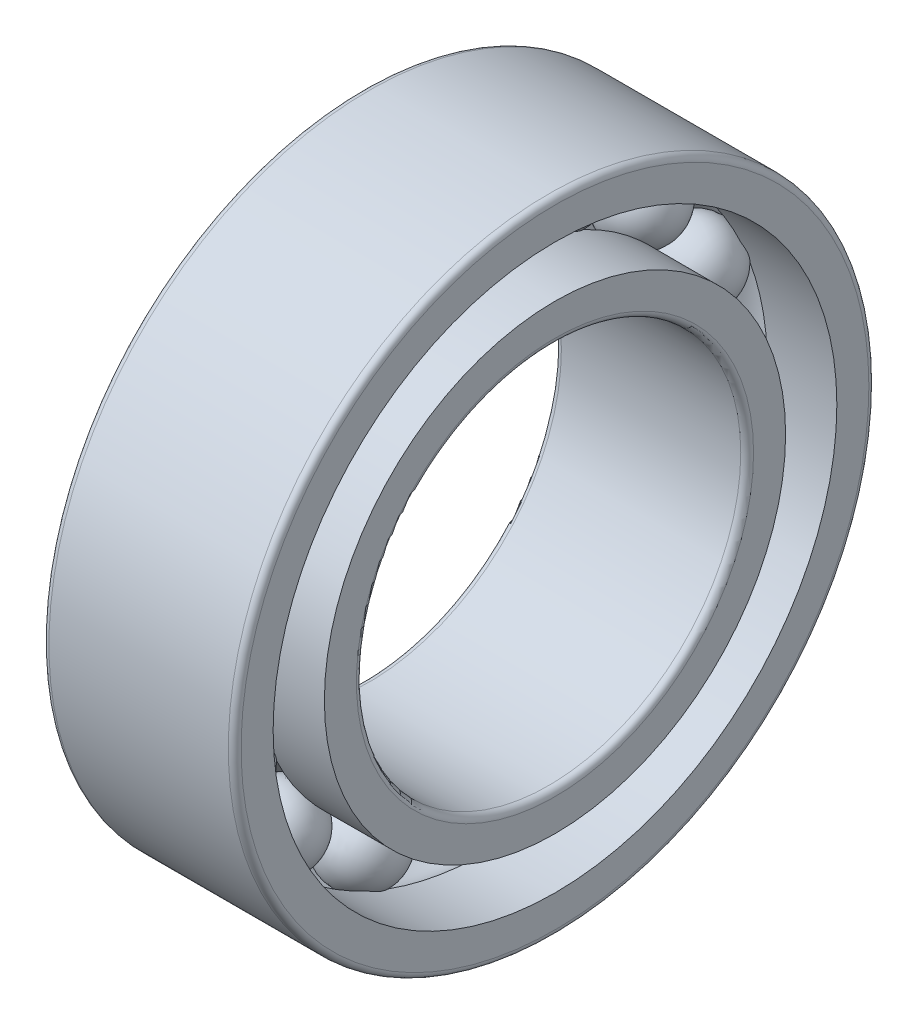
from build123d import *

# Parameters (mm, degrees)
CAGSPISKE_W         = 0.12
CAGSPISKE_H         = 0.2
CAGESPINE_ANGLE     = 0.001
BALLSDETAILED_COUNT = 16
BALLSDETAILED_ANGLE = 337.5


with BuildPart() as part:
    # CagSpiSke → CageSpine (revolve)
    with BuildSketch(Plane.XY):
        with Locations((0, 4)):
            Rectangle(CAGSPISKE_W, CAGSPISKE_H)
    revolve(axis=Axis((-20.6375, 0, 0), (-1, 0, 0)), revolution_arc=CAGESPINE_ANGLE)

    # BalDetSke → BallDetailed (revolve)
    with BuildSketch(Plane.XY):
        with BuildLine():
            Line((-0.6, 4), (0.6, 4))
            ThreePointArc((0.6, 4), (0, 3.4), (-0.6, 4))
        make_face()
    balldetailed = revolve(axis=Axis((-1.905, 4, 0), (1, 0, 0)))

    # InnRacSke → InnerRace (revolve)
    with BuildSketch(Plane.XY):
        with BuildLine():
            Line((-0.413067791, 3.6), (-1.5, 3.6))
            Line((-1.5, 3.6), (-1.5, 3.1))
            ThreePointArc((-1.5, 3.1), (-1.470710678, 3.029289322), (-1.4, 3))
            Line((-1.4, 3), (1.4, 3))
            ThreePointArc((1.4, 3), (1.470710678, 3.029289322), (1.5, 3.1))
            Line((1.5, 3.1), (1.5, 3.6))
            Line((1.5, 3.6), (0.413067791, 3.6))
            ThreePointArc((0.413067791, 3.6), (0, 3.425), (-0.413067791, 3.6))
        make_face()
    revolve(axis=Axis((-20.6375, 0, 0), (1, 0, 0)))

    # OutRacSke → OuterRace (revolve)
    with BuildSketch(Plane.XY):
        with BuildLine():
            Line((-0.413067791, 4.4), (-1.5, 4.4))
            Line((-1.5, 4.4), (-1.5, 4.9))
            ThreePointArc((-1.5, 4.9), (-1.470710678, 4.970710678), (-1.4, 5))
            Line((-1.4, 5), (1.4, 5))
            ThreePointArc((1.4, 5), (1.470710678, 4.970710678), (1.5, 4.9))
            Line((1.5, 4.9), (1.5, 4.4))
            Line((1.5, 4.4), (0.413067791, 4.4))
            ThreePointArc((0.413067791, 4.4), (0, 4.575), (-0.413067791, 4.4))
        make_face()
    revolve(axis=Axis((-20.6375, 0, 0), (1, 0, 0)))

    # BallsDetailed: BallDetailed ×16 about axis
    ballsdetailed_axis = Axis((-50, 0, 0), (1, 0, 0))
    for i in range(1, BALLSDETAILED_COUNT):
        add(balldetailed.rotate(ballsdetailed_axis, i * BALLSDETAILED_ANGLE / (BALLSDETAILED_COUNT - 1)))


solid = part.part
